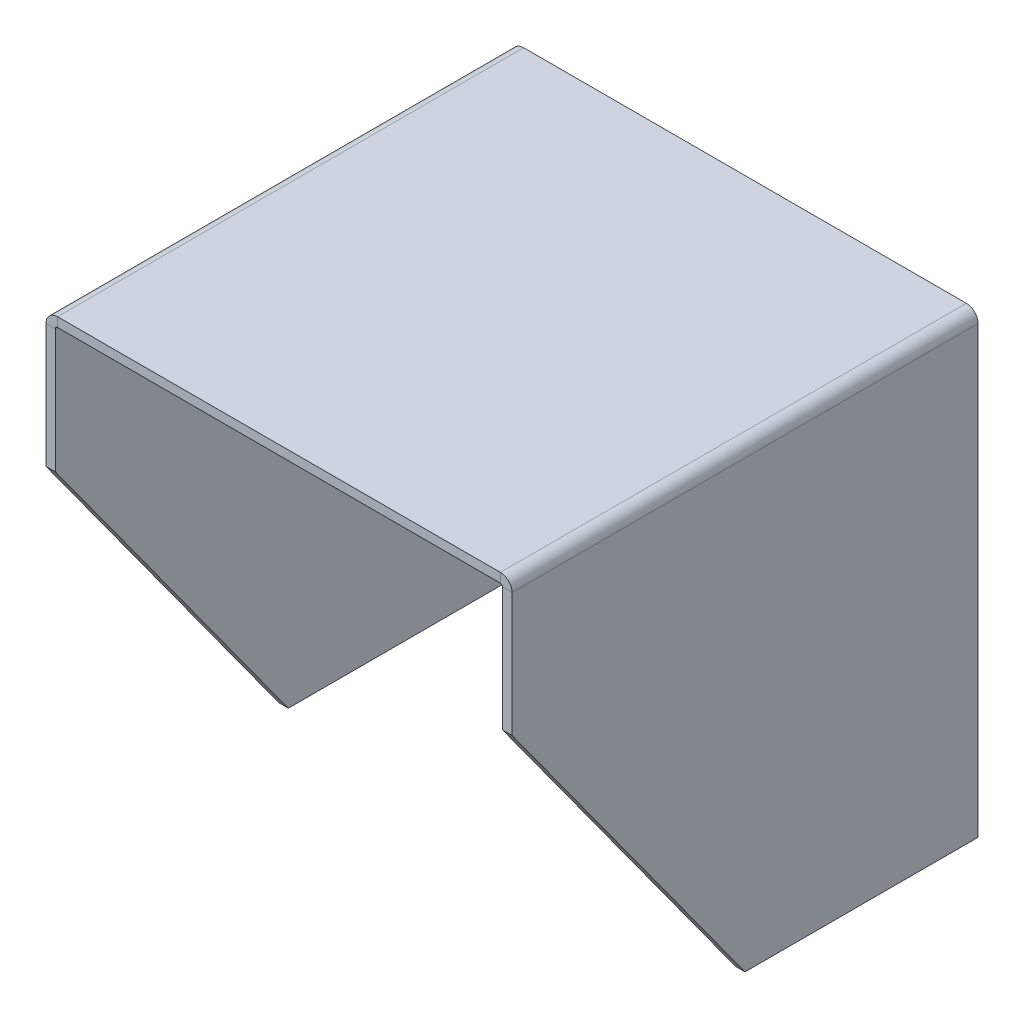
from build123d import *

# Parameters (mm, degrees)
BASE_FLANGE1_DEPTH = 150
CUT_EXTRUDE1_DEPTH = 226


# Sheet-metal steps are written as plain solids
with BuildPart() as part:
    # Sketch1 → Base-Flange1 (new body)
    with BuildSketch(Plane.XY):
        with BuildLine():
            Line((72, -72), (72, 71.2634))
            ThreePointArc((72, 71.2634), (71.784254855, 71.784254855), (71.2634, 72))
            Line((71.2634, 72), (-71.2634, 72))
            ThreePointArc((-71.2634, 72), (-71.784254855, 71.784254855), (-72, 71.2634))
            Line((-72, 71.2634), (-72, -72))
            Line((-72, -72), (-75, -72))
            Line((-75, -72), (-75, 71.2634))
            ThreePointArc((-75, 71.2634), (-73.905575199, 73.905575199), (-71.2634, 75))
            Line((-71.2634, 75), (71.2634, 75))
            ThreePointArc((71.2634, 75), (73.905575199, 73.905575199), (75, 71.2634))
            Line((75, 71.2634), (75, -72))
            Line((75, -72), (72, -72))
        make_face()
    extrude(amount=BASE_FLANGE1_DEPTH)

    # Sketch6 → Cut-Extrude1 (cut, through all)
    with BuildSketch(Plane.ZY.offset(75)):
        Polygon((75, -72), (150, 31.405620606), (170.305781078, 31.405620606), (170.305781078, -96.262552323), (75, -96.262552323), align=None)
    extrude(amount=-CUT_EXTRUDE1_DEPTH, mode=Mode.SUBTRACT)


solid = part.part
